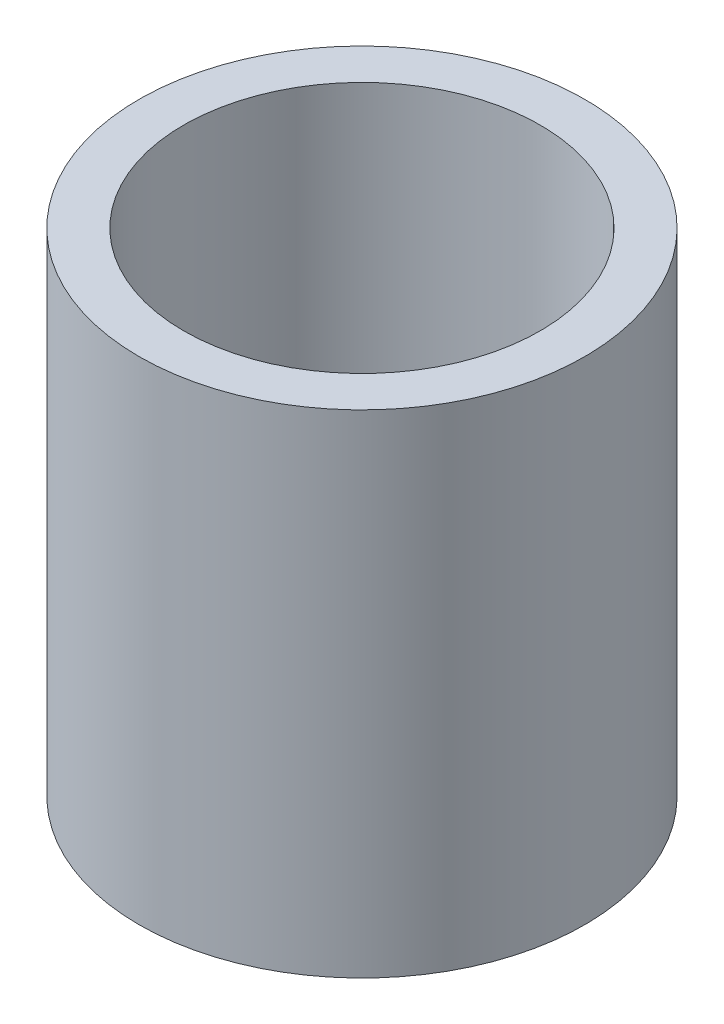
from build123d import *

# Parameters (mm, degrees)
SKETCH1_R           = 15.875
SKETCH1_R_2         = 12.7
BOSS_EXTRUDE1_DEPTH = 17.526


with BuildPart() as part:
    # Sketch1 → Boss-Extrude1 (new, symmetric)
    with BuildSketch(Plane(origin=(0, 0, 0), x_dir=(1, 0, 0), z_dir=(0, 1, 0))):
        Circle(SKETCH1_R)
        Circle(SKETCH1_R_2, mode=Mode.SUBTRACT)
    extrude(amount=BOSS_EXTRUDE1_DEPTH, both=True)


solid = part.part
